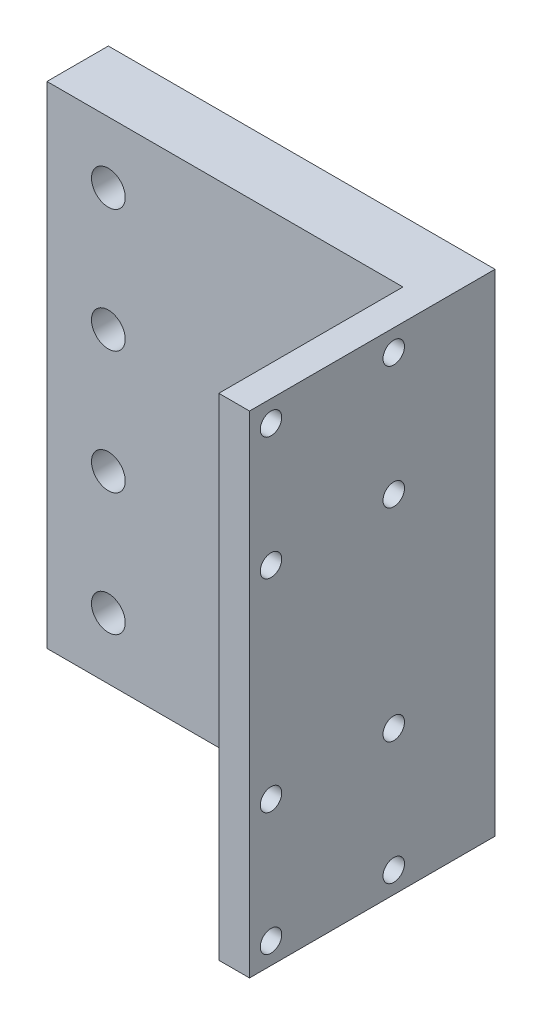
from build123d import *

# Parameters (mm, degrees)
ESQUISSE1_W             = 63
ESQUISSE1_H             = 80
ESQUISSE1_R             = 2.75
BOSS_EXTRU_1_DEPTH      = 10
ESQUISSE2_W             = 5
ESQUISSE2_H             = 80
BOSS_EXTRU_2_DEPTH      = 30
ENL_V_MAT_EXTRU_1_REACH = 95.09
ESQUISSE3_R             = 1.75
ESQUISSE4_R             = 6
ENL_V_MAT_EXTRU_2_DEPTH = 5


with BuildPart() as part:
    # Esquisse1 → Boss.-Extru.1 (new body)
    with BuildSketch(Plane.XY):
        with Locations((-1.896872358, -15.648351648)):
            Rectangle(ESQUISSE1_W, ESQUISSE1_H)
        with Locations((-23.396872358, 14.351648352)):
            Circle(ESQUISSE1_R, mode=Mode.SUBTRACT)
        with Locations((-23.396872358, -5.648351648)):
            Circle(ESQUISSE1_R, mode=Mode.SUBTRACT)
        with Locations((-23.396872358, -25.648351648)):
            Circle(ESQUISSE1_R, mode=Mode.SUBTRACT)
        with Locations((-23.396872358, -45.648351648)):
            Circle(ESQUISSE1_R, mode=Mode.SUBTRACT)
    extrude(amount=BOSS_EXTRU_1_DEPTH)

    # Esquisse2 → Boss.-Extru.2 (add)
    with BuildSketch(Plane(origin=(0, 0, 10), x_dir=(-1, 0, 0), z_dir=(0, 0, -1))):
        with Locations((-27.103127642, -15.648351648)):
            Rectangle(ESQUISSE2_W, ESQUISSE2_H)
    extrude(amount=-BOSS_EXTRU_2_DEPTH)

    # Esquisse3 → Enlèv. mat.-Extru.1 (cut, up to next)
    with BuildSketch(Plane(origin=(29.603127642, 0, 0), x_dir=(0, 0, -1), z_dir=(1, 0, 0)), mode=Mode.PRIVATE) as enl_v_mat_extru_1_sk1:
        with Locations((-36.5, -52.148351648)):
            Circle(ESQUISSE3_R)
    enl_v_mat_extru_1_tool1 = extrude(enl_v_mat_extru_1_sk1.sketch, amount=-ENL_V_MAT_EXTRU_1_REACH, mode=Mode.PRIVATE) & part.part
    # Esquisse3 → Enlèv. mat.-Extru.1 (cut, up to next)
    with BuildSketch(Plane(origin=(29.603127642, 0, 0), x_dir=(0, 0, -1), z_dir=(1, 0, 0)), mode=Mode.PRIVATE) as enl_v_mat_extru_1_sk2:
        with Locations((-36.5, -32.148351648)):
            Circle(ESQUISSE3_R)
    enl_v_mat_extru_1_tool2 = extrude(enl_v_mat_extru_1_sk2.sketch, amount=-ENL_V_MAT_EXTRU_1_REACH, mode=Mode.PRIVATE) & part.part
    # Esquisse3 → Enlèv. mat.-Extru.1 (cut, up to next)
    with BuildSketch(Plane(origin=(29.603127642, 0, 0), x_dir=(0, 0, -1), z_dir=(1, 0, 0)), mode=Mode.PRIVATE) as enl_v_mat_extru_1_sk3:
        with Locations((-16.5, -32.148351648)):
            Circle(ESQUISSE3_R)
    enl_v_mat_extru_1_tool3 = extrude(enl_v_mat_extru_1_sk3.sketch, amount=-ENL_V_MAT_EXTRU_1_REACH, mode=Mode.PRIVATE) & part.part
    # Esquisse3 → Enlèv. mat.-Extru.1 (cut, up to next)
    with BuildSketch(Plane(origin=(29.603127642, 0, 0), x_dir=(0, 0, -1), z_dir=(1, 0, 0)), mode=Mode.PRIVATE) as enl_v_mat_extru_1_sk4:
        with Locations((-16.5, -52.148351648)):
            Circle(ESQUISSE3_R)
    enl_v_mat_extru_1_tool4 = extrude(enl_v_mat_extru_1_sk4.sketch, amount=-ENL_V_MAT_EXTRU_1_REACH, mode=Mode.PRIVATE) & part.part
    # Esquisse3 → Enlèv. mat.-Extru.1 (cut, up to next)
    with BuildSketch(Plane(origin=(29.603127642, 0, 0), x_dir=(0, 0, -1), z_dir=(1, 0, 0)), mode=Mode.PRIVATE) as enl_v_mat_extru_1_sk5:
        with Locations((-36.5, 0.851648352)):
            Circle(ESQUISSE3_R)
    enl_v_mat_extru_1_tool5 = extrude(enl_v_mat_extru_1_sk5.sketch, amount=-ENL_V_MAT_EXTRU_1_REACH, mode=Mode.PRIVATE) & part.part
    # Esquisse3 → Enlèv. mat.-Extru.1 (cut, up to next)
    with BuildSketch(Plane(origin=(29.603127642, 0, 0), x_dir=(0, 0, -1), z_dir=(1, 0, 0)), mode=Mode.PRIVATE) as enl_v_mat_extru_1_sk6:
        with Locations((-36.5, 20.851648352)):
            Circle(ESQUISSE3_R)
    enl_v_mat_extru_1_tool6 = extrude(enl_v_mat_extru_1_sk6.sketch, amount=-ENL_V_MAT_EXTRU_1_REACH, mode=Mode.PRIVATE) & part.part
    # Esquisse3 → Enlèv. mat.-Extru.1 (cut, up to next)
    with BuildSketch(Plane(origin=(29.603127642, 0, 0), x_dir=(0, 0, -1), z_dir=(1, 0, 0)), mode=Mode.PRIVATE) as enl_v_mat_extru_1_sk7:
        with Locations((-16.5, 20.851648352)):
            Circle(ESQUISSE3_R)
    enl_v_mat_extru_1_tool7 = extrude(enl_v_mat_extru_1_sk7.sketch, amount=-ENL_V_MAT_EXTRU_1_REACH, mode=Mode.PRIVATE) & part.part
    # Esquisse3 → Enlèv. mat.-Extru.1 (cut, up to next)
    with BuildSketch(Plane(origin=(29.603127642, 0, 0), x_dir=(0, 0, -1), z_dir=(1, 0, 0)), mode=Mode.PRIVATE) as enl_v_mat_extru_1_sk8:
        with Locations((-16.5, 0.851648352)):
            Circle(ESQUISSE3_R)
    enl_v_mat_extru_1_tool8 = extrude(enl_v_mat_extru_1_sk8.sketch, amount=-ENL_V_MAT_EXTRU_1_REACH, mode=Mode.PRIVATE) & part.part
    add(enl_v_mat_extru_1_tool1.solids().sort_by_distance((29.603128, -52.148352, 36.5))[0], mode=Mode.SUBTRACT)
    add(enl_v_mat_extru_1_tool2.solids().sort_by_distance((29.603128, -32.148352, 36.5))[0], mode=Mode.SUBTRACT)
    add(enl_v_mat_extru_1_tool3.solids().sort_by_distance((29.603128, -32.148352, 16.5))[0], mode=Mode.SUBTRACT)
    add(enl_v_mat_extru_1_tool4.solids().sort_by_distance((29.603128, -52.148352, 16.5))[0], mode=Mode.SUBTRACT)
    add(enl_v_mat_extru_1_tool5.solids().sort_by_distance((29.603128, 0.851648, 36.5))[0], mode=Mode.SUBTRACT)
    add(enl_v_mat_extru_1_tool6.solids().sort_by_distance((29.603128, 20.851648, 36.5))[0], mode=Mode.SUBTRACT)
    add(enl_v_mat_extru_1_tool7.solids().sort_by_distance((29.603128, 20.851648, 16.5))[0], mode=Mode.SUBTRACT)
    add(enl_v_mat_extru_1_tool8.solids().sort_by_distance((29.603128, 0.851648, 16.5))[0], mode=Mode.SUBTRACT)

    # Esquisse4 → Enlèv. mat.-Extru.2 (cut)
    with BuildSketch(Plane(origin=(0, 0, 0), x_dir=(-1, 0, 0), z_dir=(0, 0, -1))):
        with Locations((23.396872358, -45.648351648)):
            Circle(ESQUISSE4_R)
        with Locations((23.396872358, -25.648351648)):
            Circle(ESQUISSE4_R)
        with Locations((23.396872358, -5.648351648)):
            Circle(ESQUISSE4_R)
        with Locations((23.396872358, 14.351648352)):
            Circle(ESQUISSE4_R)
    extrude(amount=-ENL_V_MAT_EXTRU_2_DEPTH, mode=Mode.SUBTRACT)


solid = part.part
